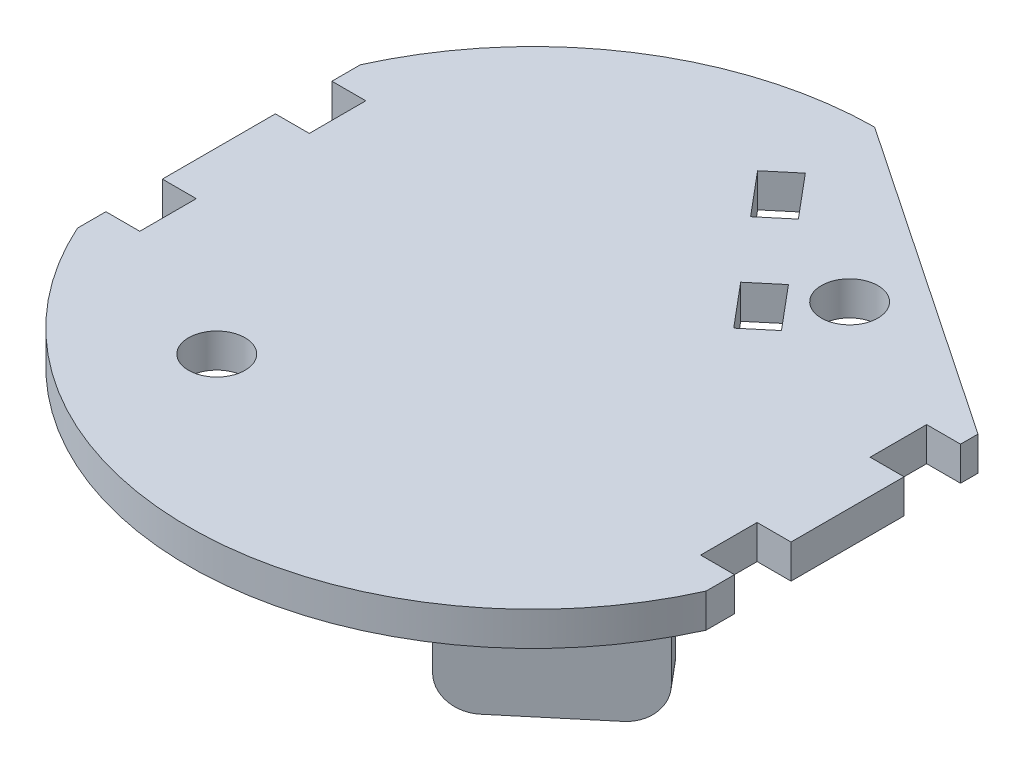
from build123d import *

# Parameters (mm, degrees)
CROQUIS1_R              = 30.5
SALIENTE_EXTRUIR1_DEPTH = 3
CORTAR_EXTRUIR3_START   = -4
CORTAR_EXTRUIR3_DEPTH   = 4
CORTAR_EXTRUIR6_DEPTH   = 10
CROQUIS10_R             = 2.5
CORTAR_EXTRUIR7_DEPTH   = 10
CORTAR_EXTRUIR8_START   = -3
CORTAR_EXTRUIR8_DEPTH   = 3
SALIENTE_EXTRUIR2_DEPTH = 10
REDONDEO1_R             = 3
REDONDEO2_R             = 1
CORTAR_EXTRUIR9_START   = -3
CORTAR_EXTRUIR9_DEPTH   = 3


with BuildPart() as part:
    # Croquis1 → Saliente-Extruir1 (new body)
    with BuildSketch(Plane(origin=(0, 0, 0), x_dir=(1, 0, 0), z_dir=(0, 1, 0))):
        Circle(CROQUIS1_R)
    extrude(amount=SALIENTE_EXTRUIR1_DEPTH)

    # Croquis5 → Cortar-Extruir3 (cut)
    with BuildSketch(Plane(origin=(0, 3, 0), x_dir=(1, 0, 0), z_dir=(0, 1, 0)).offset(CORTAR_EXTRUIR3_START)):
        with BuildLine():
            Line((30.087372767, -5), (24.814059068, -5))
            Line((24.814059068, -5), (24.814059068, -10))
            Line((24.814059068, -10), (28.814059068, -10))
            ThreePointArc((28.814059068, -10), (29.556634924, -7.526973624), (30.087372767, -5))
        make_face()
        with BuildLine():
            Line((24.814059068, 5), (30.087372767, 5))
            ThreePointArc((30.087372767, 5), (29.556634924, 7.526973624), (28.814059068, 10))
            Line((28.814059068, 10), (24.814059068, 10))
            Line((24.814059068, 10), (24.814059068, 5))
        make_face()
        with BuildLine():
            ThreePointArc((-30.087372767, -5), (-29.556634924, -7.526973624), (-28.814059068, -10))
            Line((-28.814059068, -10), (-24.814059068, -10))
            Line((-24.814059068, -10), (-24.814059068, -5))
            Line((-24.814059068, -5), (-30.087372767, -5))
        make_face()
        with BuildLine():
            Line((-24.814059068, 10), (-28.814059068, 10))
            ThreePointArc((-28.814059068, 10), (-29.556634924, 7.526973624), (-30.087372767, 5))
            Line((-30.087372767, 5), (-24.814059068, 5))
            Line((-24.814059068, 5), (-24.814059068, 10))
        make_face()
    extrude(amount=CORTAR_EXTRUIR3_DEPTH, mode=Mode.SUBTRACT)

    # Croquis9 → Cortar-Extruir6 (cut)
    with BuildSketch(Plane(origin=(0, 3, 0), x_dir=(1, 0, 0), z_dir=(0, 1, 0))):
        Polygon((7.971418181, 14.613753061), (5.673284852, 12.685390231), (8.887222901, 8.855168016), (11.18535623, 10.783530845), align=None)
        Polygon((0.177618414, 23.902041933), (-2.120514915, 21.973679104), (1.093423133, 18.143456889), (3.391556462, 20.071819718), align=None)
    extrude(amount=-CORTAR_EXTRUIR6_DEPTH, mode=Mode.SUBTRACT)

    # Croquis10 → Cortar-Extruir7 (cut)
    with BuildSketch(Plane(origin=(0, 3, 0), x_dir=(1, 0, 0), z_dir=(0, 1, 0))):
        with Locations((12, 16)):
            Circle(CROQUIS10_R)
        with Locations((-12, -16)):
            Circle(CROQUIS10_R)
    extrude(amount=-CORTAR_EXTRUIR7_DEPTH, mode=Mode.SUBTRACT)

    # Croquis11 → Cortar-Extruir8 (cut)
    with BuildSketch(Plane(origin=(0, 3, 0), x_dir=(1, 0, 0), z_dir=(0, 1, 0)).offset(CORTAR_EXTRUIR8_START)):
        with BuildLine():
            Line((30.087372767, 5), (27.814059068, 5))
            Line((27.814059068, 5), (27.814059068, -5))
            Line((27.814059068, -5), (30.087372767, -5))
            ThreePointArc((30.087372767, -5), (30.5, 0), (30.087372767, 5))
        make_face()
        with BuildLine():
            Line((-27.814059068, -5), (-27.814059068, 5))
            Line((-27.814059068, 5), (-30.087372767, 5))
            ThreePointArc((-30.087372767, 5), (-30.5, 0), (-30.087372767, -5))
            Line((-30.087372767, -5), (-27.814059068, -5))
        make_face()
        with BuildLine():
            Line((27.814059068, 12.515115586), (27.814059068, 10))
            Line((27.814059068, 10), (28.814059068, 10))
            ThreePointArc((28.814059068, 10), (28.341972277, 11.268655974), (27.814059068, 12.515115586))
        make_face()
        with BuildLine():
            Line((-27.814059068, 10), (-27.814059068, 12.515115586))
            ThreePointArc((-27.814059068, 12.515115586), (-28.341972277, 11.268655974), (-28.814059068, 10))
            Line((-28.814059068, 10), (-27.814059068, 10))
        make_face()
        with BuildLine():
            ThreePointArc((-28.814059068, -10), (-28.341972277, -11.268655974), (-27.814059068, -12.515115586))
            Line((-27.814059068, -12.515115586), (-27.814059068, -10))
            Line((-27.814059068, -10), (-28.814059068, -10))
        make_face()
        with BuildLine():
            Line((28.814059068, -10), (27.814059068, -10))
            Line((27.814059068, -10), (27.814059068, -12.515115586))
            ThreePointArc((27.814059068, -12.515115586), (28.341972277, -11.268655974), (28.814059068, -10))
        make_face()
    extrude(amount=CORTAR_EXTRUIR8_DEPTH, mode=Mode.SUBTRACT)

    # Croquis13 → Saliente-Extruir2 (add)
    with BuildSketch(Plane.XZ):
        Polygon((-6.816688183, 4.321977983), (-19.672440377, -10.99891088), (-17.374307048, -12.927273709), (-4.518554854, 2.393615154), align=None)
        Polygon((21.527275636, 8.931176939), (23.455638465, 11.229310268), (11.964971818, 20.871124414), (10.036608989, 18.572991084), align=None)
    extrude(amount=SALIENTE_EXTRUIR2_DEPTH)

    # Redondeo1
    redondeo1_edges = [part.edges().sort_by_distance(p)[0] for p in [
        (11.000790403, -10, 19.722057749),
        (22.49145705, -10, 10.080243604),
        (-5.667621519, -10, 3.357796568),
        (-18.523373712, -10, -11.963092294),
    ]]
    fillet(redondeo1_edges, radius=REDONDEO1_R)

    # Redondeo2
    redondeo2_edges = [part.edges().sort_by_distance(p)[0] for p in [
        (17.710305141, 0, 16.050217341),
        (11.000790403, 0, 19.722057749),
        (-5.667621519, 0, 3.357796568),
        (-13.24456428, 0, -3.338466449),
        (22.49145705, 0, 10.080243604),
        (-18.523373712, 0, -11.963092294),
    ]]
    fillet(redondeo2_edges, radius=REDONDEO2_R)

    # Croquis14 → Cortar-Extruir9 (cut)
    with BuildSketch(Plane(origin=(0, 3, 0), x_dir=(1, 0, 0), z_dir=(0, 1, 0)).offset(CORTAR_EXTRUIR9_START)):
        with BuildLine():
            Line((-0.28585192, 30.498660441), (27.814059068, 11.545031156))
            Line((27.814059068, 11.545031156), (27.814059068, 12.515115586))
            ThreePointArc((27.814059068, 12.515115586), (16.440879495, 25.689442995), (-0.28585192, 30.498660441))
        make_face()
    extrude(amount=CORTAR_EXTRUIR9_DEPTH, mode=Mode.SUBTRACT)


solid = part.part
